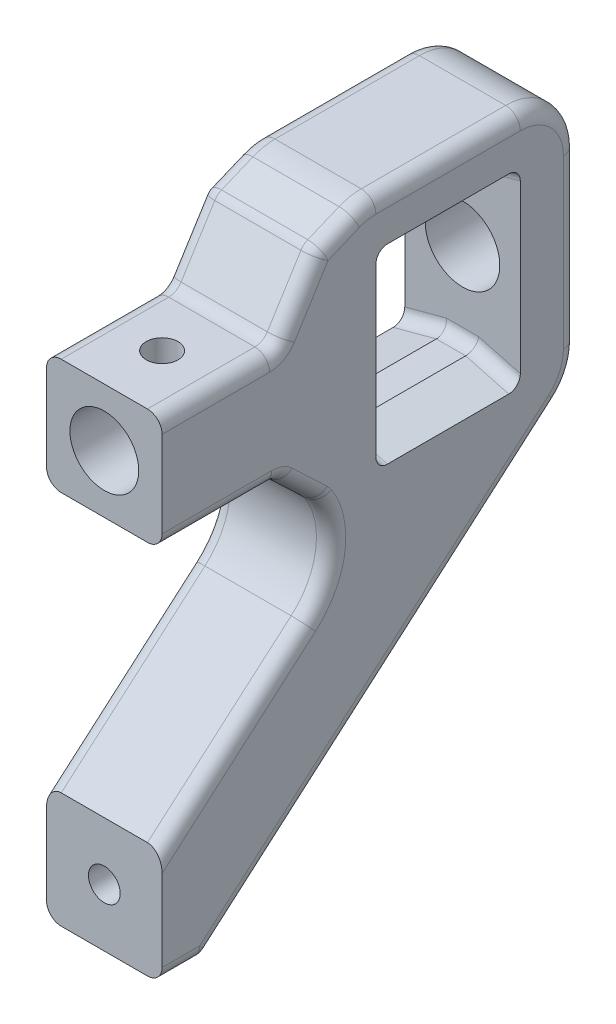
from build123d import *
from OCP.BRepFilletAPI import BRepFilletAPI_MakeChamfer

# Parameters (mm, degrees)
SKETCH1_W                    = 25
SKETCH1_H                    = 29
BOSS_EXTRUDE1_DEPTH          = 10
SKETCH6_R                    = 5.9563
CUT_EXTRUDE1_DEPTH           = 113.716458426
CUT_EXTRUDE3_REACH           = 107.891
SKETCH14_R                   = 6.45
M5_START                     = -10
M5_CLEARANCE_HOLE1_OUTLINE_R = 2.75
M5_CLEARANCE_HOLE1_DEPTH     = 20
CUT_EXTRUDE2_DEPTH           = 18
M5_CLEARANCE_HOLE2_D         = 5.5
FILLET14_R                   = 12.7
FILLET13_R                   = 10
FILLET16_R                   = 2.54
CHAMFER1_SIZE                = 2
CHAMFER1_SIZE2               = 7.464101615
CHAMFER2_SIZE                = 2
CHAMFER2_SIZE2               = 7.464101615
FILLET17_R                   = 2


# Read off the part's stored shape, not the designer's step: M5 Clearance Hole1
with BuildPart() as part:
    # Sketch1 → Boss-Extrude1 (new, symmetric)
    with BuildSketch(Plane(origin=(0, 0, 0), x_dir=(0, 0, -1), z_dir=(1, 0, 0))):
        Polygon((7.460622198, -75), (72, -19.066312341), (72, 24.5), (35.01114111, 24.5), (27, 21.182154811), (20, 10), (0, 10), (0, -10), (20, -10), (27, -16.618919561), (40.474722748, -19.922182745), (0, -55), (0, -75), align=None)
        with Locations((49.5, 0)):
            Rectangle(SKETCH1_W, SKETCH1_H, mode=Mode.SUBTRACT)
    extrude(amount=BOSS_EXTRUDE1_DEPTH, both=True)

    # Sketch6 → Cut-Extrude1 (cut, through all)
    with BuildSketch(Plane(origin=(0, -81.5, -37), x_dir=(1, 0, 0), z_dir=(0, 0, 1))):
        with Locations(Location((0, 81.5, 0), (0, 0, 180))):
            Circle(SKETCH6_R)
    extrude(amount=CUT_EXTRUDE1_DEPTH, mode=Mode.SUBTRACT)

    # Sketch14 → Cut-Extrude3 (cut, up to next)
    with BuildSketch(Plane(origin=(0, -52.5, -72), x_dir=(1, 0, 0), z_dir=(0, 0, 1)), mode=Mode.PRIVATE) as cut_extrude3_sk1:
        with Locations(Location((0, 52.5, 0), (0, 0, 180))):
            Circle(SKETCH14_R)
    cut_extrude3_tool1 = extrude(cut_extrude3_sk1.sketch, amount=CUT_EXTRUDE3_REACH, mode=Mode.PRIVATE) & part.part
    add(cut_extrude3_tool1.solids().sort_by_distance((0, 0, -72))[0], mode=Mode.SUBTRACT)

    # M5 Clearance Hole1 outline → M5 Clearance Hole1 (cut)
    with BuildSketch(Plane(origin=(0, 0, 0), x_dir=(1, 0, 0), z_dir=(0, 1, 0)).offset(M5_START)):
        with Locations((0, 10)):
            Circle(M5_CLEARANCE_HOLE1_OUTLINE_R)
    extrude(amount=M5_CLEARANCE_HOLE1_DEPTH, mode=Mode.SUBTRACT)

    # Sketch10 → Cut-Extrude2 (cut)
    with BuildSketch(Plane.XY.offset(-30)):
        with BuildLine():
            ThreePointArc((5, -65), (3.535533906, -61.464466094), (0, -60))
            Line((0, -60), (0, -70))
            ThreePointArc((0, -70), (3.535533906, -68.535533906), (5, -65))
        make_face()
        with BuildLine():
            Line((0, -70), (0, -60))
            ThreePointArc((0, -60), (-5, -65), (0, -70))
        make_face()
    extrude(amount=CUT_EXTRUDE2_DEPTH, mode=Mode.SUBTRACT)

    # M5 Clearance Hole2 (through all)
    with Locations(Plane(origin=(0, 0, -12), x_dir=(-1, 0, 0), z_dir=(0, 0, -1))):
        with Locations((0, -65)):
            Hole(M5_CLEARANCE_HOLE2_D / 2)

    # Fillet14
    # the kernel refuses this fillet: 12.7 mm, written as the material it adds along each edge
    with BuildSketch(Plane(origin=(-10, -19.922182745, -40.474722748), x_dir=(0, 0.23809523809523664, 0.9712418121129117), z_dir=(1, 0, 0))) as fillet14_piece_1:
        with BuildLine():
            CenterArc((22.296336967, 9.505223671), FILLET14_R, 144.688307267, 83.767361366)
            Line((11.932887465, 16.846130592), (11.725618475, 16.992948731))
            Line((11.725618475, 16.992948731), (-0.20726899, 0.146818138))
            Line((-0.20726899, 0.146818138), (0, -0.254))
            ThreePointArc((0, -0.254), (6.936852687, -0.254), (13.705252742, -0.190104473))
            Line((13.705252742, -0.190104473), (13.873705374, 0))
        make_face()
    extrude(amount=20)

    # Fillet13
    fillet13_edges = [part.edges().sort_by_distance(p)[0] for p in [
        (0, 24.5, -35.01114111),
        (0, 24.5, -72),
        (0, -19.066312341, -72),
    ]]
    fillet(fillet13_edges, radius=FILLET13_R)

    # Fillet16
    fillet16_edges = [part.edges().sort_by_distance(p)[0] for p in [
        (10, -48.528458156, -38.004949088),
        (10, 0, -72),
        (10, -18.653747718, -71.096503718),
        (10, 21.571067812, -69.071067812),
        (10, 24.307902492, -35.049346594),
        (-10, 10, -10),
        (-10, 15.591077405, -23.5),
        (-10, -75, -3.730311099),
        (-10, -13.30945978, -23.5),
        (-10, -10, -10),
        (10, -10, -10),
        (10, -13.30945978, -23.5),
        (0, 10, -20),
        (0, 21.182154811, -27),
        (0, -75, -7.460622198),
        (0, -16.618919561, -27),
        (0, -10, -20),
        (10, -75, -3.730311099),
        (10, 15.591077405, -23.5),
        (10, 10, -10),
        (-10, -44.221342733, -12.437010014),
        (10, -44.221342733, -12.437010014),
        (-10, -25.437608609, -29.156236253),
        (10, -25.437608609, -29.156236253),
        (-10, 22.460572534, -30.08681816),
        (10, 22.460572534, -30.08681816),
        (-10, 24.5, -49.5),
        (-10, 0, -72),
        (-10, -48.528458156, -38.004949088),
        (-10, -18.653747718, -71.096503718),
        (-10, 21.571067812, -69.071067812),
        (-10, 24.307902492, -35.049346594),
        (10, 24.5, -49.5),
    ]]
    fillet(fillet16_edges, radius=FILLET16_R)

    # Chamfer1: one chamfer whose edges measure the first distance from different faces: ONE call of the kernel's chamfer builder (chamfer() names one face for all edges)
    chamfer1_edges_1 = [part.edges().sort_by_distance(p)[0] for p in [
        (10, 14.5, -49.5),
    ]]
    chamfer1_side_1 = [part.faces().sort_by_distance(p)[0] for p in [
        (10, -18.267082867, -33.779126771),
    ]]
    chamfer1_edges_2 = [part.edges().sort_by_distance(p)[0] for p in [
        (-10, 14.5, -49.5),
    ]]
    chamfer1_side_2 = [part.faces().sort_by_distance(p)[0] for p in [
        (-10, -18.267082867, -33.779126771),
    ]]
    chamfer1 = BRepFilletAPI_MakeChamfer(part.part.solid().wrapped)
    for e in chamfer1_edges_1:
        chamfer1.Add(CHAMFER1_SIZE, CHAMFER1_SIZE2, e.wrapped, chamfer1_side_1[0].wrapped)  # the first distance lies on this face
    for e in chamfer1_edges_2:
        chamfer1.Add(CHAMFER1_SIZE, CHAMFER1_SIZE2, e.wrapped, chamfer1_side_2[0].wrapped)  # the first distance lies on this face
    add(Compound.cast(chamfer1.Shape()), mode=Mode.REPLACE)

    # Chamfer2: one chamfer whose edges measure the first distance from different faces: ONE call of the kernel's chamfer builder (chamfer() names one face for all edges)
    chamfer2_edges_1 = [part.edges().sort_by_distance(p)[0] for p in [
        (-10, -14.5, -49.5),
    ]]
    chamfer2_side_1 = [part.faces().sort_by_distance(p)[0] for p in [
        (-10, -18.927449514, -33.471681192),
    ]]
    chamfer2_edges_2 = [part.edges().sort_by_distance(p)[0] for p in [
        (10, -14.5, -49.5),
    ]]
    chamfer2_side_2 = [part.faces().sort_by_distance(p)[0] for p in [
        (10, -18.927449514, -33.471681192),
    ]]
    chamfer2 = BRepFilletAPI_MakeChamfer(part.part.solid().wrapped)
    for e in chamfer2_edges_1:
        chamfer2.Add(CHAMFER2_SIZE, CHAMFER2_SIZE2, e.wrapped, chamfer2_side_1[0].wrapped)  # the first distance lies on this face
    for e in chamfer2_edges_2:
        chamfer2.Add(CHAMFER2_SIZE, CHAMFER2_SIZE2, e.wrapped, chamfer2_side_2[0].wrapped)  # the first distance lies on this face
    add(Compound.cast(chamfer2.Shape()), mode=Mode.REPLACE)

    # Fillet17
    fillet17_edges = [part.edges().sort_by_distance(p)[0] for p in [
        (0, 14.5, -62),
        (0, 14.5, -37),
        (6.267949192, 15.5, -37),
        (6.267949192, 15.5, -62),
        (-6.267949192, 15.5, -37),
        (-6.267949192, 15.5, -62),
        (0, -14.5, -37),
        (0, -14.5, -62),
        (-6.267949192, -15.5, -62),
        (-6.267949192, -15.5, -37),
        (6.267949192, -15.5, -62),
        (6.267949192, -15.5, -37),
    ]]
    fillet(fillet17_edges, radius=FILLET17_R)


solid = part.part
